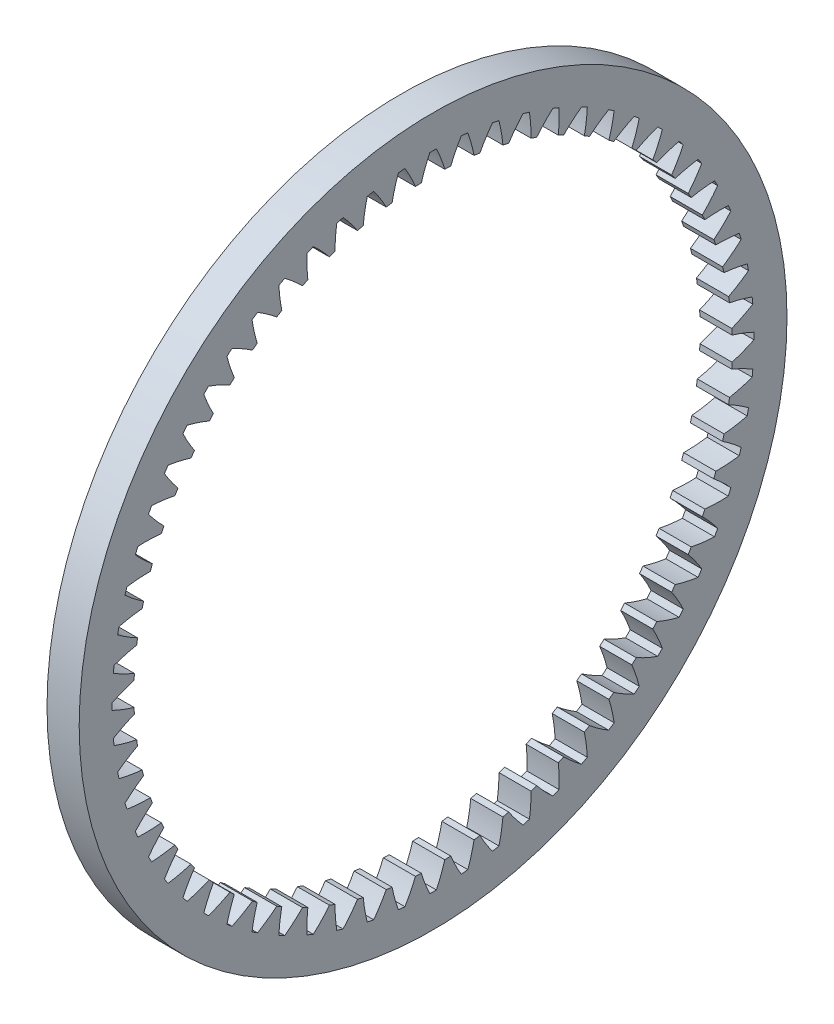
from build123d import *

# Parameters (mm, degrees)
BASPROSKE_W     = 10
BASPROSKE_H     = 17
TOOTHCUT_DEPTH  = 156.884572681
TEETHCUTS_COUNT = 64
TEETHCUTS_ANGLE = 354.375


with BuildPart() as part:
    # BasProSke → Base-Revolve (revolve)
    with BuildSketch(Plane(origin=(0, 0, 0), x_dir=(1, 0, 0), z_dir=(0, 1, 0))):
        with Locations((5, 101.5)):
            Rectangle(BASPROSKE_W, BASPROSKE_H)
    revolve(axis=Axis((-10, 0, 0), (1, 0, 0)))

    # TooCutSke → ToothCut (cut, through all)
    with BuildSketch(Plane(origin=(0, 0, 0), x_dir=(0, 0, -1), z_dir=(1, 0, 0))):
        with BuildLine():
            ThreePointArc((3.648079857, 92.903001881), (2.468462078, 96.374437712), (1.027320289, 99.745709753))
            ThreePointArc((1.027320289, 99.745709753), (0, 99.751), (-1.027320289, 99.745709753))
            ThreePointArc((-1.027320289, 99.745709753), (-2.468462078, 96.374437712), (-3.648079857, 92.903001881))
            ThreePointArc((-3.648079857, 92.903001881), (0, 92.9746), (3.648079857, 92.903001881))
        make_face()
    toothcut = extrude(amount=TOOTHCUT_DEPTH, mode=Mode.SUBTRACT)

    # TeethCuts: ToothCut ×64 about axis
    teethcuts_axis = Axis((-10, 0, 0), (1, 0, 0))
    for i in range(1, TEETHCUTS_COUNT):
        add(toothcut.rotate(teethcuts_axis, i * TEETHCUTS_ANGLE / (TEETHCUTS_COUNT - 1)), mode=Mode.SUBTRACT)


solid = part.part
